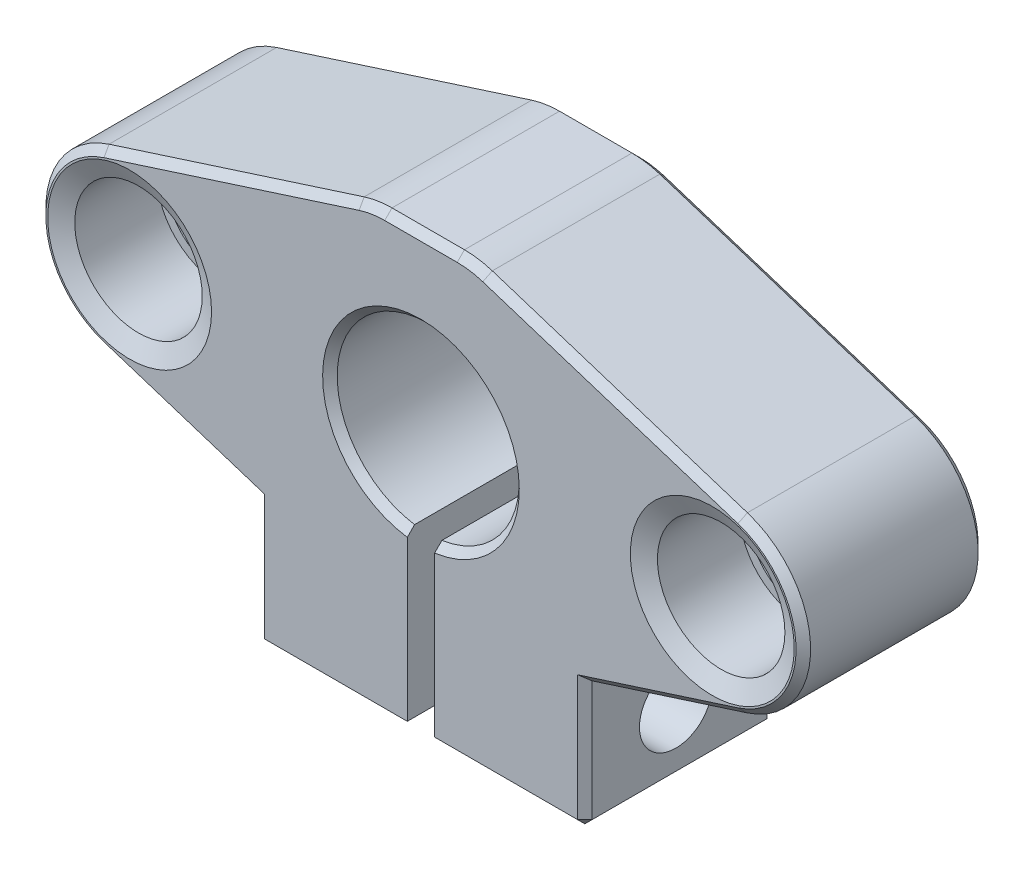
from build123d import *

# Parameters (mm, degrees)
BOSS_EXTRUDE1_DEPTH             = 10
CUT_EXTRUDE1_DEPTH              = 28.408940147
CUT_EXTRUDE2_DEPTH              = 28.408940147
DRAFT1_ANGLE                    = 30
SKETCH4_W                       = 5
SKETCH4_H                       = 10
SKETCH5_W                       = 2
SKETCH5_H                       = 20.25
F_4_0_4_DIAMETER_HOLE2_D        = 4
F_4_0_4_DIAMETER_HOLE2_DEPTH    = 20.25
M7X1_0_TAPPED_HOLE1_D           = 6
M7X1_0_TAPPED_HOLE1_CBORE_D     = 7
M7X1_0_TAPPED_HOLE1_CBORE_DEPTH = 5
FILLET1_R                       = 5
CHAMFER1_SIZE                   = 1
CHAMFER1_SIZE2                  = 0.487732589
CHAMFER2_SIZE                   = 0.4
CHAMFER3_SIZE                   = 1
CHAMFER3_SIZE2                  = 0.487732589


with BuildPart() as part:
    # Sketch1 → Boss-Extrude1 (new body)
    with BuildSketch(Plane.XY.offset(10)):
        with BuildLine():
            Line((-9, -7.5), (-9, -14.5))
            Line((-9, -14.5), (9, -14.5))
            Line((9, -14.5), (9, -7.5))
            Line((9, -7.5), (17.529062862, -4.760458672))
            ThreePointArc((17.529062862, -4.760458672), (21, 0), (17.529062862, 4.760458672))
            Line((17.529062862, 4.760458672), (2.773364341, 9.5))
            Line((2.773364341, 9.5), (-2.773364341, 9.5))
            Line((-2.773364341, 9.5), (-17.529062862, 4.760458672))
            ThreePointArc((-17.529062862, 4.760458672), (-21, 0), (-17.529062862, -4.760458672))
            Line((-17.529062862, -4.760458672), (-9, -7.5))
        make_face()
    extrude(amount=-BOSS_EXTRUDE1_DEPTH)

    # Sketch2 → Cut-Extrude1 (cut, through all)
    with BuildSketch(Plane(origin=(0, 0, 0), x_dir=(-1, 0, 0), z_dir=(0, 0, -1))):
        Polygon((9, -11.230940108), (9, -10.769059892), (8.2, -10.769059892), align=None)
    extrude(amount=-CUT_EXTRUDE1_DEPTH, mode=Mode.SUBTRACT)

    # Sketch3 → Cut-Extrude2 (cut, through all)
    with BuildSketch(Plane(origin=(0, 0, 0), x_dir=(-1, 0, 0), z_dir=(0, 0, -1))):
        with BuildLine():
            Line((0.75, -14.5), (0.75, -4.943429983))
            ThreePointArc((0.75, -4.943429983), (0, -5), (-0.75, -4.943429983))
            Line((-0.75, -4.943429983), (-0.75, -14.5))
            Line((-0.75, -14.5), (0.75, -14.5))
        make_face()
    extrude(amount=-CUT_EXTRUDE2_DEPTH, mode=Mode.SUBTRACT)

    # Draft1
    draft1_faces = [part.faces().sort_by_distance(p)[0] for p in [
        (-8.6, -10.769059892, 5),
    ]]
    draft(draft1_faces, Plane(origin=(-9, -7.5, 0), x_dir=(0, 0, -1), z_dir=(-1, 0, 0)), DRAFT1_ANGLE)

    # Sketch4 → Cut-Revolve1 (revolve, cut)
    with BuildSketch(Plane.XZ):
        with Locations((2.5, 5)):
            Rectangle(SKETCH4_W, SKETCH4_H)
    revolve(axis=Axis((0, 0, 10), (0, 0, -1)), mode=Mode.SUBTRACT)

    # Sketch5 → Ø4.0 (4) Diameter Hole1 (revolve, cut)
    with BuildSketch(Plane(origin=(-0.75, -11, 5), x_dir=(0, 0, -1), z_dir=(0, 1, 0))):
        with Locations((1, 10.125)):
            Rectangle(SKETCH5_W, SKETCH5_H)
    revolve(axis=Axis((5.6, -11, 5), (-1, 0, 0)), mode=Mode.SUBTRACT)

    # Ø4.0 (4) Diameter Hole2
    with Locations(Plane.ZY.offset(-0.75)):
        with Locations((5, -11)):
            Hole(F_4_0_4_DIAMETER_HOLE2_D / 2, depth=F_4_0_4_DIAMETER_HOLE2_DEPTH)

    # M7x1.0 Tapped Hole1 (through all)
    with Locations(Plane.XY.offset(10)):
        with Locations((-16, 0), (16, 0)):
            CounterBoreHole(M7X1_0_TAPPED_HOLE1_D / 2, M7X1_0_TAPPED_HOLE1_CBORE_D / 2, M7X1_0_TAPPED_HOLE1_CBORE_DEPTH)

    # Fillet1
    fillet1_edges = [part.edges().sort_by_distance(p)[0] for p in [
        (-2.773364341, 9.5, 5),
        (2.773364341, 9.5, 5),
    ]]
    fillet(fillet1_edges, radius=FILLET1_R)

    # Chamfer1
    chamfer1_edges = [part.edges().sort_by_distance(p)[0] for p in [
        (12.5, 0, 10),
        (-19.5, 0, 10),
    ]]
    chamfer1_side = [part.faces().sort_by_distance(p)[0] for p in [
        (0, 9.016264535, 10),
    ]]
    chamfer(chamfer1_edges, length=CHAMFER1_SIZE, length2=CHAMFER1_SIZE2, reference=chamfer1_side[0])

    # Chamfer2
    chamfer2_edges = [part.edges().sort_by_distance(p)[0] for p in [
        (13.264531431, -6.130229336, 0),
        (21, 0, 0),
        (10.524097746, 7.010458672, 0),
        (2.763925905, 9.439751682, 0),
        (0, 9.5, 0),
        (-2.763925905, 9.439751682, 0),
        (-10.524097746, 7.010458672, 0),
        (-13.264531431, -6.130229336, 0),
        (-21, 0, 0),
        (-9, -9.134529946, 10),
        (-13.264531431, -6.130229336, 10),
        (-21, 0, 10),
        (-10.524097746, 7.010458672, 10),
        (-2.763925905, 9.439751682, 10),
        (0, 9.5, 10),
        (2.763925905, 9.439751682, 10),
        (10.524097746, 7.010458672, 10),
        (21, 0, 10),
        (13.264531431, -6.130229336, 10),
        (9, -11, 10),
        (4.875, -14.5, 10),
        (9, -14.5, 5),
        (0.75, -14.5, 5),
        (4.875, -14.5, 0),
        (0, 5, 10),
        (-9, -12.865470054, 10),
        (-9, -14.5, 5),
        (-4.875, -14.5, 0),
        (-0.75, -14.5, 5),
        (-4.875, -14.5, 10),
        (0, 5, 0),
    ]]
    chamfer(chamfer2_edges, length=CHAMFER2_SIZE - 0.0001)  # a hair under: the kernel refuses the full size

    # Chamfer3
    chamfer3_edges = [part.edges().sort_by_distance(p)[0] for p in [
        (19, 0, 0),
        (-13, 0, 0),
    ]]
    chamfer3_side = [part.faces().sort_by_distance(p)[0] for p in [
        (4.875, -13.627267497, 0),
    ]]
    chamfer(chamfer3_edges, length=CHAMFER3_SIZE, length2=CHAMFER3_SIZE2, reference=chamfer3_side[0])


solid = part.part
